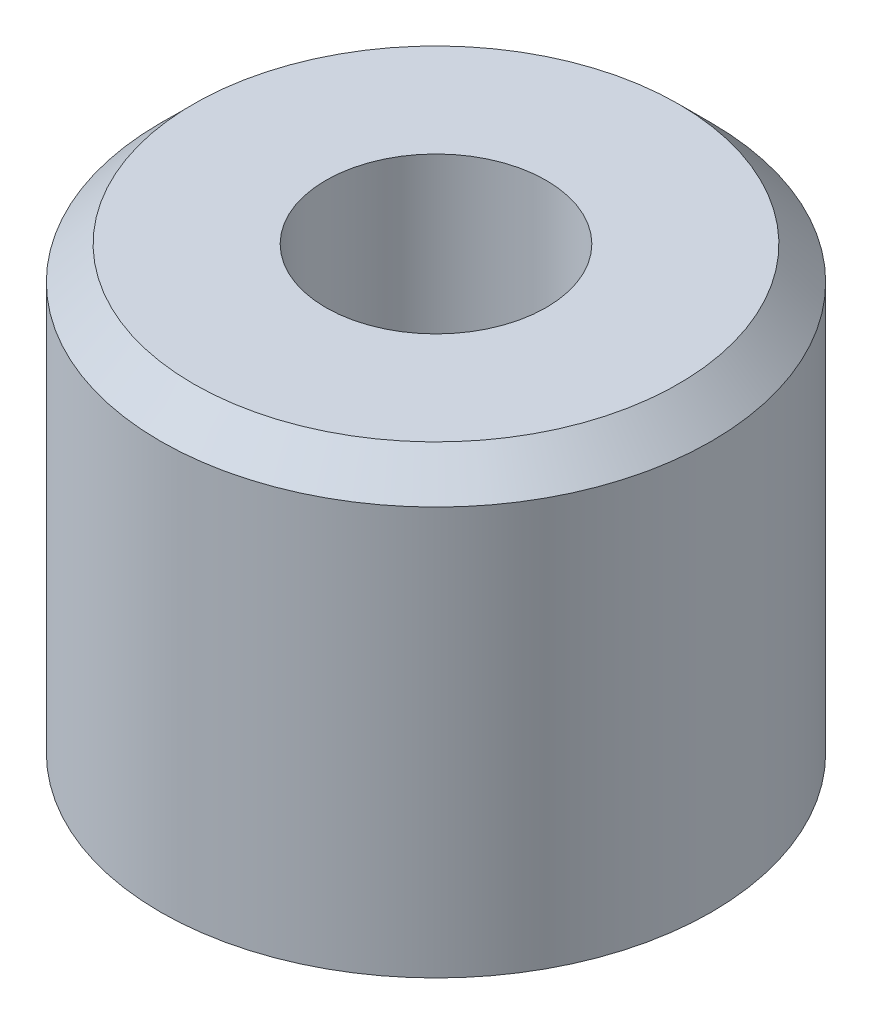
from build123d import *

# Parameters (mm, degrees)
SKETCH1_R           = 63.5
BOSS_EXTRUDE1_DEPTH = 101.6
SKETCH2_R           = 25.4
CUT_EXTRUDE1_DEPTH  = 88.9
FILLET1_SIZE        = 7.62


with BuildPart() as part:
    # Sketch1 → Boss-Extrude1 (new body)
    with BuildSketch(Plane(origin=(0, 0, 0), x_dir=(1, 0, 0), z_dir=(0, 1, 0))):
        Circle(SKETCH1_R)
    extrude(amount=BOSS_EXTRUDE1_DEPTH)

    # Sketch2 → Cut-Extrude1 (cut)
    with BuildSketch(Plane(origin=(0, 101.6, 0), x_dir=(1, 0, 0), z_dir=(0, 1, 0))):
        Circle(SKETCH2_R)
    extrude(amount=-CUT_EXTRUDE1_DEPTH, mode=Mode.SUBTRACT)

    # Fillet1
    fillet1_edges = [part.edges().sort_by_distance(p)[0] for p in [
        (-63.5, 101.6, 0),
    ]]
    chamfer(fillet1_edges, length=FILLET1_SIZE)


solid = part.part
